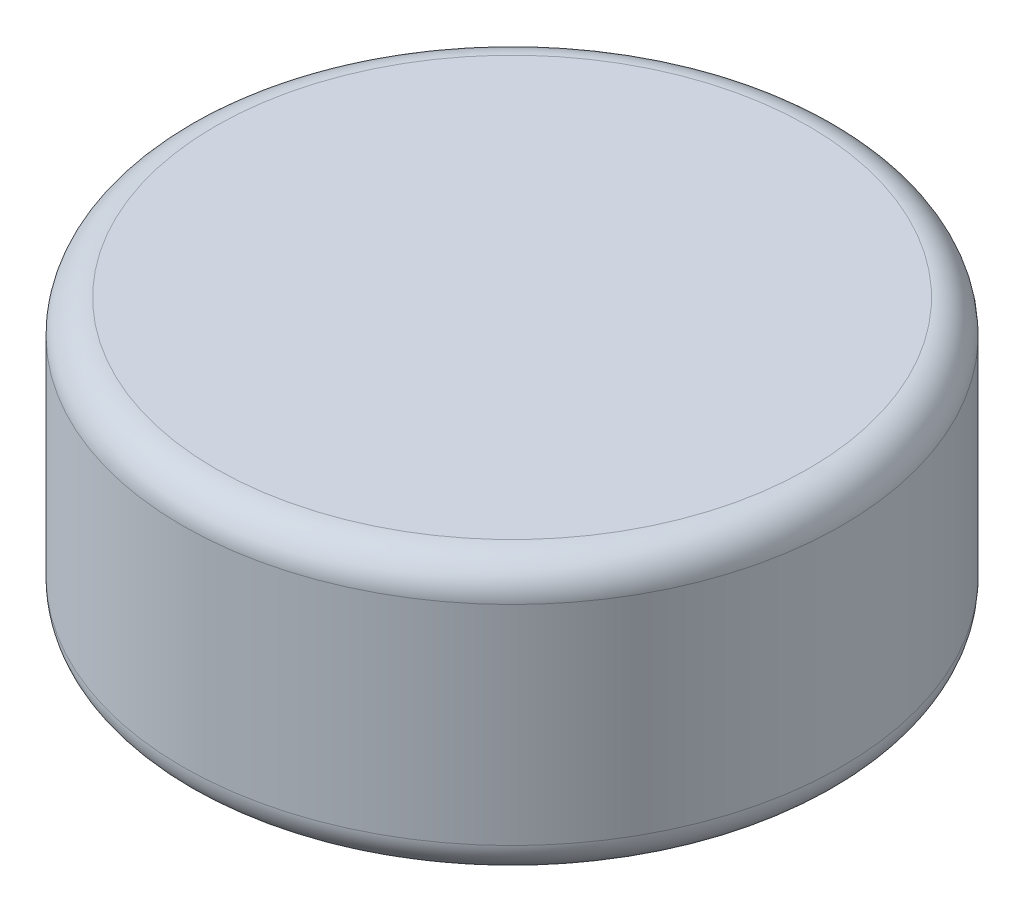
from build123d import *

# Parameters (mm, degrees)
SKETCH1_R           = 3
BOSS_EXTRUDE1_DEPTH = 2.5
FILLET1_R           = 0.3


with BuildPart() as part:
    # Sketch1 → Boss-Extrude1 (new body)
    with BuildSketch(Plane(origin=(0, 0, 0), x_dir=(1, 0, 0), z_dir=(0, 1, 0))):
        Circle(SKETCH1_R)
    extrude(amount=BOSS_EXTRUDE1_DEPTH)

    # Fillet1
    fillet1_edges = [part.edges().sort_by_distance(p)[0] for p in [
        (-3, 2.5, 0),
        (-3, 0, 0),
    ]]
    fillet(fillet1_edges, radius=FILLET1_R)


solid = part.part
